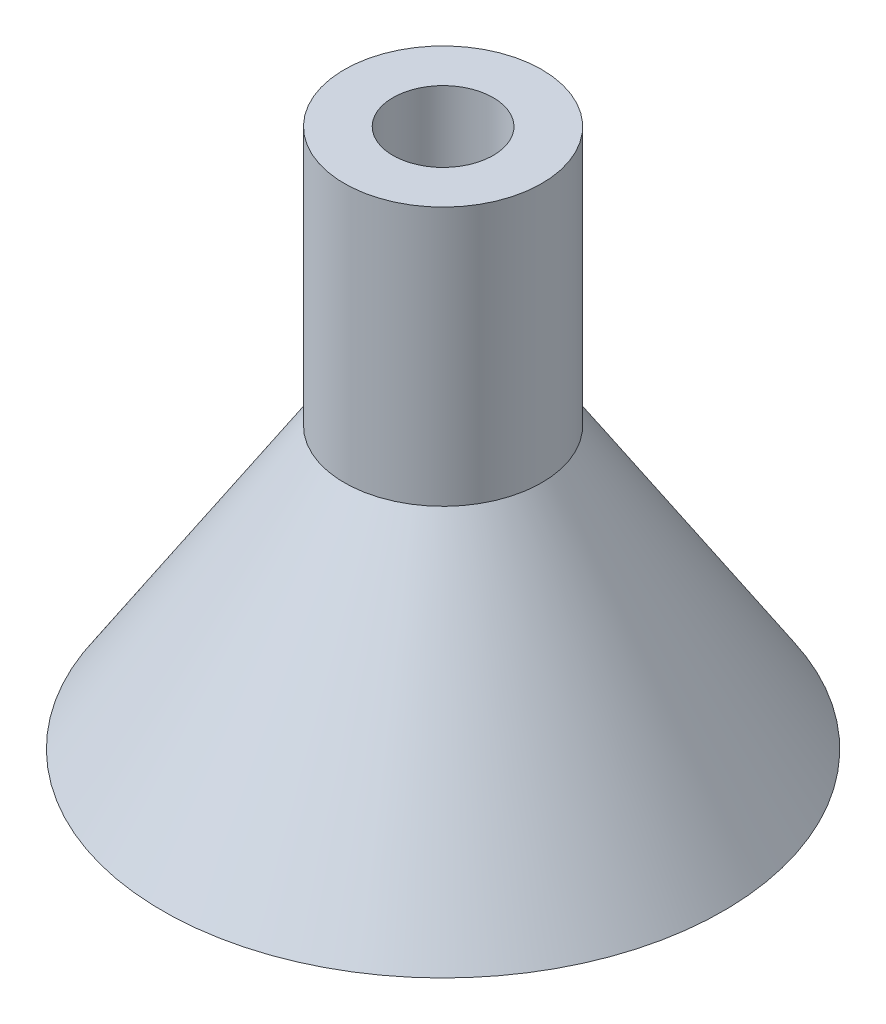
from build123d import *


with BuildPart() as part:
    # Sketch2 → Revolve1 (revolve)
    with BuildSketch(Plane.XY):
        Polygon((14.219765898, 0), (17.31991046, 0), (6.096, 17.283306474), (6.096, 33.283306474), (3.096, 33.283306474), (3.096, 17.129097373), align=None)
    revolve(axis=Axis((0, 0, 0), (0, 1, 0)))


solid = part.part
